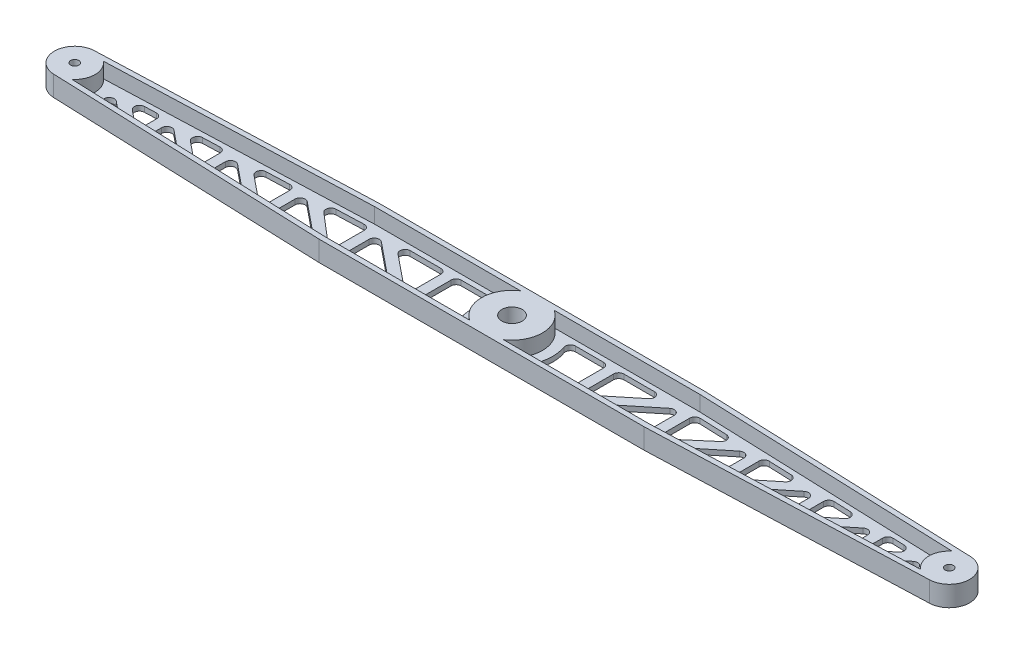
from build123d import *

# Parameters (mm, degrees)
SKETCH1_W            = 38.1
SKETCH1_H            = 12.7
BOSS_EXTRUDE1_DEPTH  = 292.1
SKETCH2_R            = 6.35
PIVOT_HOLE_DEPTH     = 293.995908675
END_HOLES_D          = 5.1054
CUT_EXTRUDE3_REACH   = 294.996
CUT_EXTRUDE4_DEPTH   = 9.525
CUT_EXTRUDE5_REACH   = 288.543
FILLET3_R            = 3.175
FILLET3_OF_MIRROR1_R = 3.175


with BuildPart() as part:
    # Sketch1 → Boss-Extrude1 (new, symmetric)
    with BuildSketch(Plane(origin=(0, 0, 0), x_dir=(0, 0, -1), z_dir=(1, 0, 0))):
        Rectangle(SKETCH1_W, SKETCH1_H)
    extrude(amount=BOSS_EXTRUDE1_DEPTH, both=True)

    # Sketch2 → Pivot Hole (cut, through all)
    with BuildSketch(Plane(origin=(0, 6.35, 0), x_dir=(1, 0, 0), z_dir=(0, 1, 0))):
        Circle(SKETCH2_R)
    extrude(amount=-PIVOT_HOLE_DEPTH, mode=Mode.SUBTRACT)

    # End Holes (through all)
    with Locations(Plane(origin=(0, -6.35, 0), x_dir=(-1, 0, 0), z_dir=(0, -1, 0))):
        with Locations((273.05, 0), (-273.05, 0)):
            Hole(END_HOLES_D / 2)

    # Sketch7 → Cut-Extrude3 (cut, up to next)
    with BuildSketch(Plane(origin=(0, 6.35, 0), x_dir=(1, 0, 0), z_dir=(0, 1, 0)), mode=Mode.PRIVATE) as cut_extrude3_sk1:
        with BuildLine():
            Line((292.1, 19.05), (101.6, 19.05))
            Line((101.6, 19.05), (273.519406165, 12.691322148))
            ThreePointArc((273.519406165, 12.691322148), (285.75, 0), (273.519406165, -12.691322148))
            Line((273.519406165, -12.691322148), (101.6, -19.05))
            Line((101.6, -19.05), (292.1, -19.05))
            Line((292.1, -19.05), (292.1, 19.05))
        make_face()
    cut_extrude3_tool1 = extrude(cut_extrude3_sk1.sketch, amount=-CUT_EXTRUDE3_REACH, mode=Mode.PRIVATE) & part.part
    # Sketch7 → Cut-Extrude3 (cut, up to next)
    with BuildSketch(Plane(origin=(0, 6.35, 0), x_dir=(1, 0, 0), z_dir=(0, 1, 0)), mode=Mode.PRIVATE) as cut_extrude3_sk2:
        with BuildLine():
            Line((-273.519406165, 12.691322148), (-101.6, 19.05))
            Line((-101.6, 19.05), (-292.1, 19.05))
            Line((-292.1, 19.05), (-292.1, -19.05))
            Line((-292.1, -19.05), (-101.6, -19.05))
            Line((-101.6, -19.05), (-273.519406165, -12.691322148))
            ThreePointArc((-273.519406165, -12.691322148), (-285.75, 0), (-273.519406165, 12.691322148))
        make_face()
    cut_extrude3_tool2 = extrude(cut_extrude3_sk2.sketch, amount=-CUT_EXTRUDE3_REACH, mode=Mode.PRIVATE) & part.part
    add(cut_extrude3_tool1.solids().sort_by_distance((196.85, 6.35, -17.107274))[0], mode=Mode.SUBTRACT)
    add(cut_extrude3_tool2.solids().sort_by_distance((-187.631508, 6.35, 17.81206))[0], mode=Mode.SUBTRACT)

    # Sketch9 → Cut-Extrude4 (cut)
    with BuildSketch(Plane(origin=(0, 6.35, 0), x_dir=(1, 0, 0), z_dir=(0, 1, 0))):
        with BuildLine():
            Line((-265.007534071, 9.828974604), (-101.6, 15.872829053))
            Line((-101.6, 15.872829053), (-10.533555802, 15.872829053))
            ThreePointArc((-10.533555802, 15.872829053), (-19.05, 0), (-10.533555802, -15.872829053))
            Line((-10.533555802, -15.872829053), (-101.6, -15.872829053))
            Line((-101.6, -15.872829053), (-265.007534071, -9.828974604))
            ThreePointArc((-265.007534071, -9.828974604), (-260.35, 0), (-265.007534071, 9.828974604))
        make_face()
        with BuildLine():
            Line((101.6, -15.872829053), (265.007534071, -9.828974604))
            ThreePointArc((265.007534071, -9.828974604), (260.35, 0), (265.007534071, 9.828974604))
            Line((265.007534071, 9.828974604), (101.6, 15.872829053))
            Line((101.6, 15.872829053), (10.533555802, 15.872829053))
            ThreePointArc((10.533555802, 15.872829053), (19.05, 0), (10.533555802, -15.872829053))
            Line((10.533555802, -15.872829053), (101.6, -15.872829053))
        make_face()
    extrude(amount=-CUT_EXTRUDE4_DEPTH, mode=Mode.SUBTRACT)

    # Sketch10 → Cut-Extrude5 (cut, up to next)
    with BuildSketch(Plane(origin=(0, -3.175, 0), x_dir=(1, 0, 0), z_dir=(0, 1, 0)), mode=Mode.PRIVATE) as cut_extrude5_sk1:
        Polygon((-130.055079824, 11.643207485), (-101.6, 12.695658107), (-101.6, -12.695658107), align=None)
    cut_extrude5_tool1 = extrude(cut_extrude5_sk1.sketch, amount=-CUT_EXTRUDE5_REACH, mode=Mode.PRIVATE) & part.part
    # Sketch10 → Cut-Extrude5 (cut, up to next)
    with BuildSketch(Plane(origin=(0, -3.175, 0), x_dir=(1, 0, 0), z_dir=(0, 1, 0)), mode=Mode.PRIVATE) as cut_extrude5_sk2:
        Polygon((-140.112148049, 11.271232858), (-111.055289307, -12.345941109), (-140.112148049, -11.271232858), align=None)
    cut_extrude5_tool2 = extrude(cut_extrude5_sk2.sketch, amount=-CUT_EXTRUDE5_REACH, mode=Mode.PRIVATE) & part.part
    # Sketch10 → Cut-Extrude5 (cut, up to next)
    with BuildSketch(Plane(origin=(0, -3.175, 0), x_dir=(1, 0, 0), z_dir=(0, 1, 0)), mode=Mode.PRIVATE) as cut_extrude5_sk3:
        Polygon((-95.25, 12.695658107), (-95.25, -12.695658107), (-64.010365252, -12.695658107), align=None)
    cut_extrude5_tool3 = extrude(cut_extrude5_sk3.sketch, amount=-CUT_EXTRUDE5_REACH, mode=Mode.PRIVATE) & part.part
    # Sketch10 → Cut-Extrude5 (cut, up to next)
    with BuildSketch(Plane(origin=(0, -3.175, 0), x_dir=(1, 0, 0), z_dir=(0, 1, 0)), mode=Mode.PRIVATE) as cut_extrude5_sk4:
        Polygon((-85.182284223, 12.695658107), (-53.942649475, -12.695658107), (-53.942649475, 12.695658107), align=None)
    cut_extrude5_tool4 = extrude(cut_extrude5_sk4.sketch, amount=-CUT_EXTRUDE5_REACH, mode=Mode.PRIVATE) & part.part
    # Sketch10 → Cut-Extrude5 (cut, up to next)
    with BuildSketch(Plane(origin=(0, -3.175, 0), x_dir=(1, 0, 0), z_dir=(0, 1, 0)), mode=Mode.PRIVATE) as cut_extrude5_sk5:
        with BuildLine():
            Line((-255.336463177, 7.009501638), (-237.266204005, -7.677855254))
            Line((-237.266204005, -7.677855254), (-255.336463177, -7.009501638))
            ThreePointArc((-255.336463177, -7.009501638), (-254, 0), (-255.336463177, 7.009501638))
        make_face()
    cut_extrude5_tool5 = extrude(cut_extrude5_sk5.sketch, amount=-CUT_EXTRUDE5_REACH, mode=Mode.PRIVATE) & part.part
    # Sketch10 → Cut-Extrude5 (cut, up to next)
    with BuildSketch(Plane(origin=(0, -3.175, 0), x_dir=(1, 0, 0), z_dir=(0, 1, 0)), mode=Mode.PRIVATE) as cut_extrude5_sk6:
        Polygon((-245.706942313, 7.365662832), (-226.718511576, -8.067976298), (-226.718511576, 8.067976298), align=None)
    cut_extrude5_tool6 = extrude(cut_extrude5_sk6.sketch, amount=-CUT_EXTRUDE5_REACH, mode=Mode.PRIVATE) & part.part
    # Sketch10 → Cut-Extrude5 (cut, up to next)
    with BuildSketch(Plane(origin=(0, -3.175, 0), x_dir=(1, 0, 0), z_dir=(0, 1, 0)), mode=Mode.PRIVATE) as cut_extrude5_sk7:
        Polygon((-220.368511576, 8.302839862), (-220.368511576, -8.302839862), (-198.964070017, -9.094512841), align=None)
    cut_extrude5_tool7 = extrude(cut_extrude5_sk7.sketch, amount=-CUT_EXTRUDE5_REACH, mode=Mode.PRIVATE) & part.part
    # Sketch10 → Cut-Extrude5 (cut, up to next)
    with BuildSketch(Plane(origin=(0, -3.175, 0), x_dir=(1, 0, 0), z_dir=(0, 1, 0)), mode=Mode.PRIVATE) as cut_extrude5_sk8:
        Polygon((-210.738990712, 8.659001056), (-188.416377588, -9.484633885), (-188.416377588, 9.484633885), align=None)
    cut_extrude5_tool8 = extrude(cut_extrude5_sk8.sketch, amount=-CUT_EXTRUDE5_REACH, mode=Mode.PRIVATE) & part.part
    # Sketch10 → Cut-Extrude5 (cut, up to next)
    with BuildSketch(Plane(origin=(0, -3.175, 0), x_dir=(1, 0, 0), z_dir=(0, 1, 0)), mode=Mode.PRIVATE) as cut_extrude5_sk9:
        Polygon((-182.066377588, 9.719497449), (-182.066377588, -9.719497449), (-157.009840477, -10.646248251), align=None)
    cut_extrude5_tool9 = extrude(cut_extrude5_sk9.sketch, amount=-CUT_EXTRUDE5_REACH, mode=Mode.PRIVATE) & part.part
    # Sketch10 → Cut-Extrude5 (cut, up to next)
    with BuildSketch(Plane(origin=(0, -3.175, 0), x_dir=(1, 0, 0), z_dir=(0, 1, 0)), mode=Mode.PRIVATE) as cut_extrude5_sk10:
        Polygon((-172.436856725, 10.075658643), (-146.462148049, -11.036369295), (-146.462148049, 11.036369295), align=None)
    cut_extrude5_tool10 = extrude(cut_extrude5_sk10.sketch, amount=-CUT_EXTRUDE5_REACH, mode=Mode.PRIVATE) & part.part
    # Sketch10 → Cut-Extrude5 (cut, up to next)
    with BuildSketch(Plane(origin=(0, -3.175, 0), x_dir=(1, 0, 0), z_dir=(0, 1, 0)), mode=Mode.PRIVATE) as cut_extrude5_sk11:
        with BuildLine():
            Line((-47.592649475, 12.695658107), (-47.592649475, -12.695658107))
            Line((-47.592649475, -12.695658107), (-21.999551478, -12.695658107))
            ThreePointArc((-21.999551478, -12.695658107), (-25.4, 0), (-21.999551478, 12.695658107))
            Line((-21.999551478, 12.695658107), (-47.592649475, 12.695658107))
        make_face()
    cut_extrude5_tool11 = extrude(cut_extrude5_sk11.sketch, amount=-CUT_EXTRUDE5_REACH, mode=Mode.PRIVATE) & part.part
    cut_extrude5_1 = cut_extrude5_tool1.solids().sort_by_distance((-111.085027, -3.175, -3.881069))[0]
    add(cut_extrude5_1, mode=Mode.SUBTRACT)
    cut_extrude5_2 = cut_extrude5_tool2.solids().sort_by_distance((-130.426528, -3.175, 4.115314))[0]
    add(cut_extrude5_2, mode=Mode.SUBTRACT)
    cut_extrude5_3 = cut_extrude5_tool3.solids().sort_by_distance((-84.836788, -3.175, 4.231886))[0]
    add(cut_extrude5_3, mode=Mode.SUBTRACT)
    cut_extrude5_4 = cut_extrude5_tool4.solids().sort_by_distance((-64.355861, -3.175, -4.231886))[0]
    add(cut_extrude5_4, mode=Mode.SUBTRACT)
    cut_extrude5_5 = cut_extrude5_tool5.solids().sort_by_distance((-248.70792, -3.175, 2.841521))[0]
    add(cut_extrude5_5, mode=Mode.SUBTRACT)
    cut_extrude5_6 = cut_extrude5_tool6.solids().sort_by_distance((-233.047988, -3.175, -2.455221))[0]
    add(cut_extrude5_6, mode=Mode.SUBTRACT)
    cut_extrude5_7 = cut_extrude5_tool7.solids().sort_by_distance((-213.233698, -3.175, 3.031504))[0]
    add(cut_extrude5_7, mode=Mode.SUBTRACT)
    cut_extrude5_8 = cut_extrude5_tool8.solids().sort_by_distance((-195.857249, -3.175, -2.886334))[0]
    add(cut_extrude5_8, mode=Mode.SUBTRACT)
    cut_extrude5_9 = cut_extrude5_tool9.solids().sort_by_distance((-173.714199, -3.175, 3.548749))[0]
    add(cut_extrude5_9, mode=Mode.SUBTRACT)
    cut_extrude5_10 = cut_extrude5_tool10.solids().sort_by_distance((-155.120384, -3.175, -3.358553))[0]
    add(cut_extrude5_10, mode=Mode.SUBTRACT)
    cut_extrude5_11 = cut_extrude5_tool11.solids().sort_by_distance((-35.924096, -3.175, 0))[0]
    add(cut_extrude5_11, mode=Mode.SUBTRACT)
    cut_extrude5 = cut_extrude5_1 + cut_extrude5_2 + cut_extrude5_3 + cut_extrude5_4 + cut_extrude5_5 + cut_extrude5_6 + cut_extrude5_7 + cut_extrude5_8 + cut_extrude5_9 + cut_extrude5_10 + cut_extrude5_11  # Cut-Extrude5 as one shape, for the pattern or mirror that repeats it

    # Fillet3
    fillet3_edges = [part.edges().sort_by_distance(p)[0] for p in [
        (-21.999551478, -4.7625, 12.695658107),
        (-21.999551478, -4.7625, -12.695658107),
        (-47.592649475, -4.7625, -12.695658107),
        (-47.592649475, -4.7625, 12.695658107),
        (-53.942649475, -4.7625, 12.695658107),
        (-53.942649475, -4.7625, -12.695658107),
        (-85.182284223, -4.7625, -12.695658107),
        (-64.010365252, -4.7625, 12.695658107),
        (-95.25, -4.7625, -12.695658107),
        (-95.25, -4.7625, 12.695658107),
        (-101.6, -4.7625, 12.695658107),
        (-130.055079824, -4.7625, -11.643207485),
        (-101.6, -4.7625, -12.695658107),
        (-111.055289307, -4.7625, 12.345941109),
        (-140.112148049, -4.7625, -11.271232858),
        (-140.112148049, -4.7625, 11.271232858),
        (-146.462148049, -4.7625, 11.036369295),
        (-146.462148049, -4.7625, -11.036369295),
        (-172.436856725, -4.7625, -10.075658643),
        (-157.009840477, -4.7625, 10.646248251),
        (-182.066377588, -4.7625, -9.719497449),
        (-182.066377588, -4.7625, 9.719497449),
        (-188.416377588, -4.7625, 9.484633885),
        (-188.416377588, -4.7625, -9.484633885),
        (-210.738990712, -4.7625, -8.659001056),
        (-198.964070017, -4.7625, 9.094512841),
        (-220.368511576, -4.7625, -8.302839862),
        (-220.368511576, -4.7625, 8.302839862),
        (-226.718511576, -4.7625, 8.067976298),
        (-226.718511576, -4.7625, -8.067976298),
        (-245.706942313, -4.7625, -7.365662832),
        (-237.266204005, -4.7625, 7.677855254),
        (-255.336463177, -4.7625, 7.009501638),
        (-255.336463177, -4.7625, -7.009501638),
    ]]
    fillet(fillet3_edges, radius=FILLET3_R)

    # Mirror1: Cut-Extrude5 across plane
    add(cut_extrude5.mirror(Plane(origin=(0, 0, 0), x_dir=(0, 0, 1), z_dir=(1, 0, 0))), mode=Mode.SUBTRACT)

    # Fillet3 of Mirror1
    fillet3_of_mirror1_edges = [part.edges().sort_by_distance(p)[0] for p in [
        (21.999551478, -4.7625, 12.695658107),
        (21.999551478, -4.7625, -12.695658107),
        (47.592649475, -4.7625, -12.695658107),
        (47.592649475, -4.7625, 12.695658107),
        (53.942649475, -4.7625, 12.695658107),
        (53.942649475, -4.7625, -12.695658107),
        (85.182284223, -4.7625, -12.695658107),
        (64.010365252, -4.7625, 12.695658107),
        (95.25, -4.7625, -12.695658107),
        (95.25, -4.7625, 12.695658107),
        (101.6, -4.7625, 12.695658107),
        (130.055079824, -4.7625, -11.643207485),
        (101.6, -4.7625, -12.695658107),
        (111.055289307, -4.7625, 12.345941109),
        (140.112148049, -4.7625, -11.271232858),
        (140.112148049, -4.7625, 11.271232858),
        (146.462148049, -4.7625, 11.036369295),
        (146.462148049, -4.7625, -11.036369295),
        (172.436856725, -4.7625, -10.075658643),
        (157.009840477, -4.7625, 10.646248251),
        (182.066377588, -4.7625, -9.719497449),
        (182.066377588, -4.7625, 9.719497449),
        (188.416377588, -4.7625, 9.484633885),
        (188.416377588, -4.7625, -9.484633885),
        (210.738990712, -4.7625, -8.659001056),
        (198.964070017, -4.7625, 9.094512841),
        (220.368511576, -4.7625, -8.302839862),
        (220.368511576, -4.7625, 8.302839862),
        (226.718511576, -4.7625, 8.067976298),
        (226.718511576, -4.7625, -8.067976298),
        (245.706942313, -4.7625, -7.365662832),
        (237.266204005, -4.7625, 7.677855254),
        (255.336463177, -4.7625, 7.009501638),
        (255.336463177, -4.7625, -7.009501638),
    ]]
    fillet(fillet3_of_mirror1_edges, radius=FILLET3_OF_MIRROR1_R)


solid = part.part
